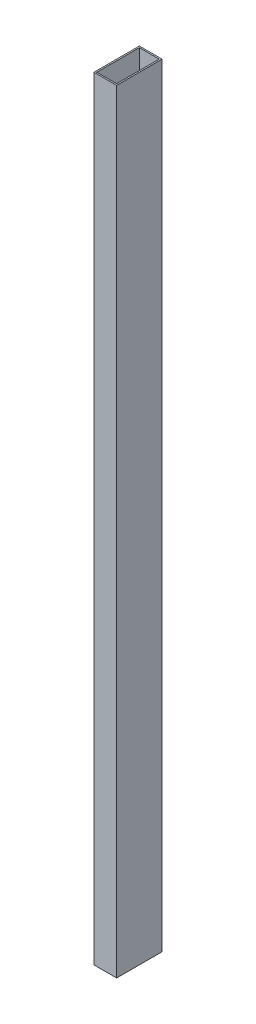
from build123d import *

# Parameters (mm, degrees)
SKETCH1_W           = 25.4
SKETCH1_H           = 50.8
SKETCH1_W_2         = 22.225
SKETCH1_H_2         = 47.625
EXTRUDE_THIN1_DEPTH = 863.6


with BuildPart() as part:
    # Sketch1 → Extrude-Thin1 (new body)
    with BuildSketch(Plane(origin=(0, 0, 0), x_dir=(1, 0, 0), z_dir=(0, 1, 0))):
        Rectangle(SKETCH1_W, SKETCH1_H)
        Rectangle(SKETCH1_W_2, SKETCH1_H_2, mode=Mode.SUBTRACT)
    extrude(amount=EXTRUDE_THIN1_DEPTH)


solid = part.part
